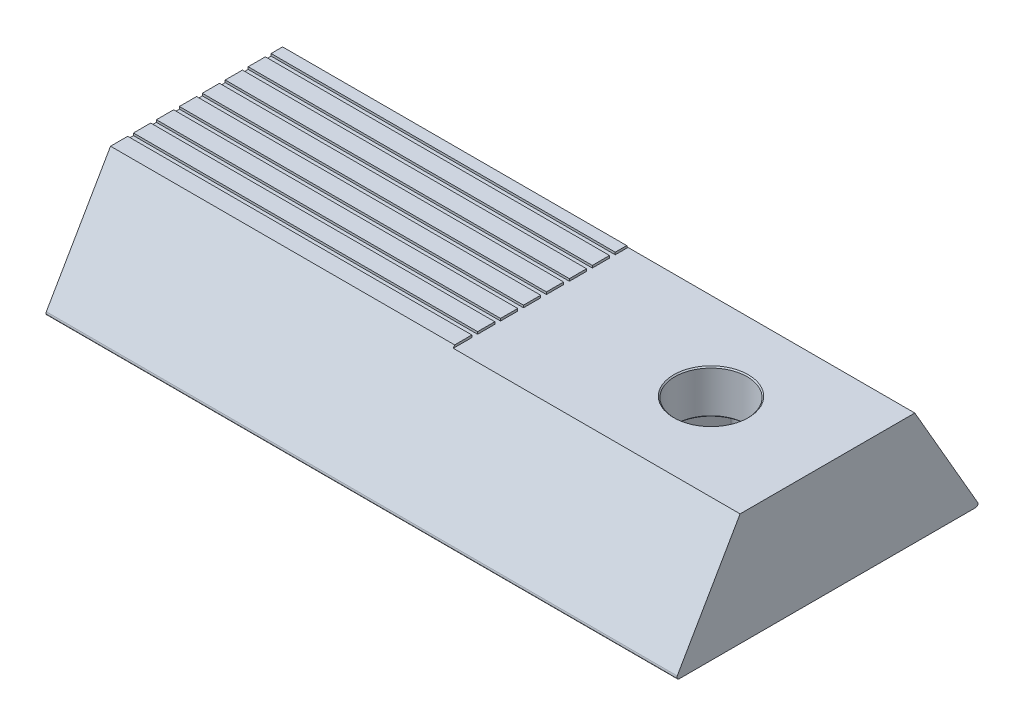
from build123d import *

# Parameters (mm, degrees)
SKETCH1_R                       = 3.15
BOSS_EXTRUDE1_DEPTH             = 10
CUT_EXTRUDE2_DEPTH              = 42.907636536
CUT_EXTRUDE2_DEPTH_BACK         = 42.907636536
SKETCH2_W                       = 0.5
SKETCH2_H                       = 0.2
BOSS_EXTRUDE2_REACH             = 43.908
BOSS_EXTRUDE2_DIRECTION_2_REACH = 43.908
SKETCH10_W                      = 15.230940108
SKETCH10_H                      = 0.2
CUT_EXTRUDE6_DEPTH              = 25
CUT_EXTRUDE5_DEPTH              = 6
FILLET3_R                       = 0.5
CHAMFER1_SIZE                   = 0.1


with BuildPart() as part:
    # Sketch1 → Boss-Extrude1 (new body)
    with BuildSketch(Plane(origin=(0, 0, 0), x_dir=(1, 0, 0), z_dir=(0, 1, 0))):
        Polygon((-15, -7.5), (15, -7.5), (40, -7.5), (40, 7.5), (15, 7.5), (-15, 7.5), align=None)
        with Locations((29.85, 0)):
            Circle(SKETCH1_R, mode=Mode.SUBTRACT)
    extrude(amount=BOSS_EXTRUDE1_DEPTH)

    # Sketch2 → Cut-Extrude2 (cut, two sides: drawn at the far end of the back side and taken through both)
    with BuildSketch(Plane(origin=(0, 0, 0), x_dir=(0, 0, -1), z_dir=(1, 0, 0)).offset(-CUT_EXTRUDE2_DEPTH_BACK)):
        with Locations((-5.75, 9.9)):
            Rectangle(SKETCH2_W, SKETCH2_H)
        with Locations((-3.75, 9.9)):
            Rectangle(SKETCH2_W, SKETCH2_H)
        with Locations((-1.75, 9.9)):
            Rectangle(SKETCH2_W, SKETCH2_H)
        with Locations((0.25, 9.9)):
            Rectangle(SKETCH2_W, SKETCH2_H)
        with Locations((2.25, 9.9)):
            Rectangle(SKETCH2_W, SKETCH2_H)
        with Locations((4.25, 9.9)):
            Rectangle(SKETCH2_W, SKETCH2_H)
        with Locations((6.25, 9.9)):
            Rectangle(SKETCH2_W, SKETCH2_H)
    extrude(amount=CUT_EXTRUDE2_DEPTH + CUT_EXTRUDE2_DEPTH_BACK, mode=Mode.SUBTRACT)

    # Boss-Extrude2: up to this face of the body (flat: up to its plane)
    boss_extrude2_end = Plane(part.part.faces().sort_by_distance((40, 4.977026122, 0.001172137))[0])
    # Sketch3 → Boss-Extrude2 (add, up to the picked face)
    with BuildSketch(Plane(origin=(0, 0, 0), x_dir=(0, 0, -1), z_dir=(1, 0, 0)), mode=Mode.PRIVATE) as boss_extrude2_sk1:
        with BuildLine():
            Line((7.5, 10), (13.097822121, 0.304287674))
            ThreePointArc((13.097822121, 0.304287674), (13.097822121, 0.101429225), (12.92214155, 0))
            Line((12.92214155, 0), (7.5, 0))
            Line((7.5, 0), (7.5, 10))
        make_face()
    boss_extrude2_tool1 = split(extrude(boss_extrude2_sk1.sketch, amount=BOSS_EXTRUDE2_REACH, mode=Mode.PRIVATE), bisect_by=boss_extrude2_end, keep=Keep.BOTH, mode=Mode.PRIVATE)
    # Sketch3 → Boss-Extrude2 (add, up to the picked face)
    with BuildSketch(Plane(origin=(0, 0, 0), x_dir=(0, 0, -1), z_dir=(1, 0, 0)), mode=Mode.PRIVATE) as boss_extrude2_sk2:
        with BuildLine():
            Line((-7.5, 0), (-7.5, 10))
            Line((-7.5, 10), (-13.097822121, 0.304287674))
            ThreePointArc((-13.097822121, 0.304287674), (-13.097822121, 0.101429225), (-12.92214155, 0))
            Line((-12.92214155, 0), (-7.5, 0))
        make_face()
    boss_extrude2_tool2 = split(extrude(boss_extrude2_sk2.sketch, amount=BOSS_EXTRUDE2_REACH, mode=Mode.PRIVATE), bisect_by=boss_extrude2_end, keep=Keep.BOTH, mode=Mode.PRIVATE)
    add(boss_extrude2_tool1.solids().sort_by(Axis((0, 3.336518, -9.420866), (1, 0, 0)))[0])
    add(boss_extrude2_tool2.solids().sort_by(Axis((0, 3.336518, 9.420866), (1, 0, 0)))[0])

    # Boss-Extrude2 direction 2: up to this face of the body (flat: up to its plane)
    boss_extrude2_direction_2_end = Plane(part.part.faces().sort_by_distance((-15, 4.977026122, 0.001172137))[0])
    # Sketch3 → Boss-Extrude2 direction 2 (add, up to the picked face)
    with BuildSketch(Plane(origin=(0, 0, 0), x_dir=(0, 0, -1), z_dir=(1, 0, 0)), mode=Mode.PRIVATE) as boss_extrude2_direction_2_sk1:
        with BuildLine():
            Line((7.5, 10), (13.097822121, 0.304287674))
            ThreePointArc((13.097822121, 0.304287674), (13.097822121, 0.101429225), (12.92214155, 0))
            Line((12.92214155, 0), (7.5, 0))
            Line((7.5, 0), (7.5, 10))
        make_face()
    boss_extrude2_direction_2_tool1 = split(extrude(boss_extrude2_direction_2_sk1.sketch, amount=-BOSS_EXTRUDE2_DIRECTION_2_REACH, mode=Mode.PRIVATE), bisect_by=boss_extrude2_direction_2_end, keep=Keep.BOTH, mode=Mode.PRIVATE)
    # Sketch3 → Boss-Extrude2 direction 2 (add, up to the picked face)
    with BuildSketch(Plane(origin=(0, 0, 0), x_dir=(0, 0, -1), z_dir=(1, 0, 0)), mode=Mode.PRIVATE) as boss_extrude2_direction_2_sk2:
        with BuildLine():
            Line((-7.5, 0), (-7.5, 10))
            Line((-7.5, 10), (-13.097822121, 0.304287674))
            ThreePointArc((-13.097822121, 0.304287674), (-13.097822121, 0.101429225), (-12.92214155, 0))
            Line((-12.92214155, 0), (-7.5, 0))
        make_face()
    boss_extrude2_direction_2_tool2 = split(extrude(boss_extrude2_direction_2_sk2.sketch, amount=-BOSS_EXTRUDE2_DIRECTION_2_REACH, mode=Mode.PRIVATE), bisect_by=boss_extrude2_direction_2_end, keep=Keep.BOTH, mode=Mode.PRIVATE)
    add(boss_extrude2_direction_2_tool1.solids().sort_by(Axis((0, 3.336518, -9.420866), (-1, 0, 0)))[0])
    add(boss_extrude2_direction_2_tool2.solids().sort_by(Axis((0, 3.336518, 9.420866), (-1, 0, 0)))[0])

    # Sketch10 → Cut-Extrude6 (cut)
    with BuildSketch(Plane(origin=(40, 0, 0), x_dir=(0, 0, -1), z_dir=(1, 0, 0))):
        with Locations((0, 9.9)):
            Rectangle(SKETCH10_W, SKETCH10_H)
    extrude(amount=-CUT_EXTRUDE6_DEPTH, mode=Mode.SUBTRACT)

    # Sketch8 → Cut-Extrude5 (cut)
    with BuildSketch(Plane.XZ):
        Polygon((26.905513627, -5.1), (32.794486373, -5.1), (35.738972746, 0), (32.794486373, 5.1), (26.905513627, 5.1), (23.961027254, 0), align=None)
    extrude(amount=-CUT_EXTRUDE5_DEPTH, mode=Mode.SUBTRACT)

    # Fillet3
    fillet3_edges = [part.edges().sort_by_distance(p)[0] for p in [
        (32.794486373, 3, -5.1),
        (26.905513627, 3, -5.1),
        (23.961027254, 3, 0),
        (26.905513627, 3, 5.1),
        (32.794486373, 3, 5.1),
        (35.738972746, 3, 0),
    ]]
    fillet(fillet3_edges, radius=FILLET3_R)

    # Chamfer1
    chamfer1_edges = [part.edges().sort_by_distance(p)[0] for p in [
        (26.7, 6, 0),
        (26.7, 9.8, 0),
    ]]
    chamfer(chamfer1_edges, length=CHAMFER1_SIZE)


solid = part.part
